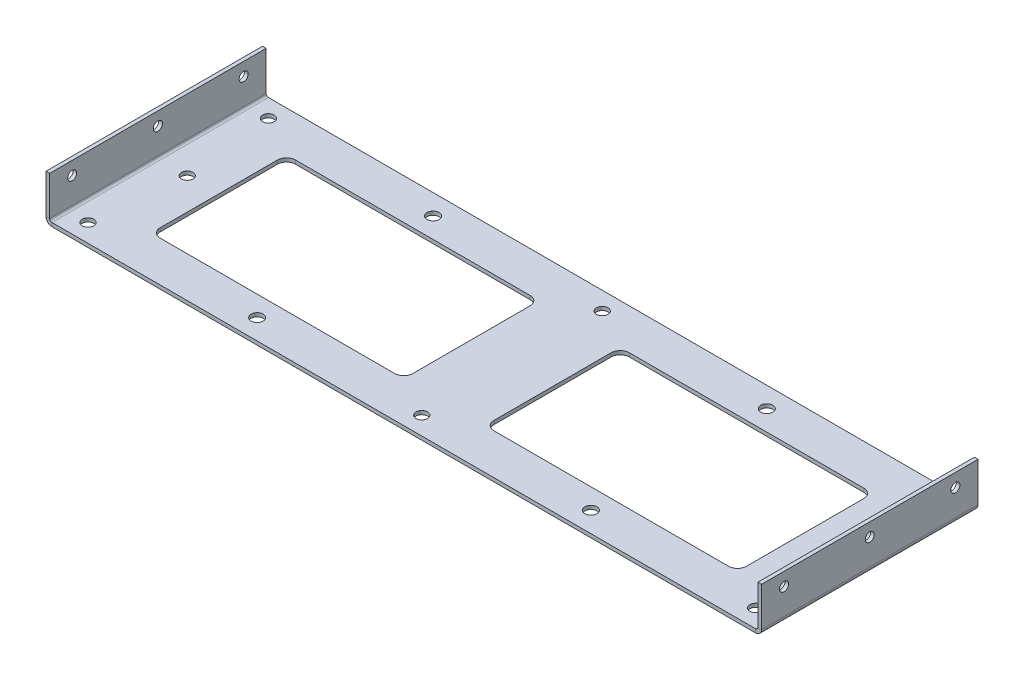
from build123d import *

# Parameters (mm, degrees)
SKETCH1_W               = 390
SKETCH1_H               = 120
SKETCH1_R               = 3.2
BOSS_EXTRUDE1_DEPTH     = 2.03
EDGE_FLANGE1_DEPTH      = 120
EDGE_FLANGE1_BEND_DEPTH = 120
CUT_EXTRUDE1_REACH      = 210.681
CUT_EXTRUDE2_DEPTH      = 209.447861347
CUT_EXTRUDE2_DEPTH_BACK = 209.447861347
SKETCH19_R              = 2.5
SKETCH20_R              = 3.35
CUT_EXTRUDE3_DEPTH      = 209.447861347
SKETCH21_R              = 3.175
CUT_EXTRUDE4_DEPTH      = 209.681312053


# Sheet-metal steps are written as plain solids
with BuildPart() as part:
    # Sketch1 → Boss-Extrude1 (new body)
    with BuildSketch(Plane(origin=(0, 0, 0), x_dir=(1, 0, 0), z_dir=(0, 1, 0))):
        Rectangle(SKETCH1_W, SKETCH1_H)
        with Locations(Location((0, 50, 0), (0, 0, 270))):
            Circle(SKETCH1_R, mode=Mode.SUBTRACT)
        with Locations(Location((-185, 50, 0), (0, 0, 270))):
            Circle(SKETCH1_R, mode=Mode.SUBTRACT)
        with Locations(Location((-185, -50, 0), (0, 0, 270))):
            Circle(SKETCH1_R, mode=Mode.SUBTRACT)
        with Locations(Location((0, -50, 0), (0, 0, 270))):
            Circle(SKETCH1_R, mode=Mode.SUBTRACT)
        with Locations(Location((185, -50, 0), (0, 0, 270))):
            Circle(SKETCH1_R, mode=Mode.SUBTRACT)
        with Locations(Location((185, 50, 0), (0, 0, 270))):
            Circle(SKETCH1_R, mode=Mode.SUBTRACT)
    extrude(amount=-BOSS_EXTRUDE1_DEPTH)

    # Edge-Flange1 section (across the edge) → Edge-Flange1 (add)
    with BuildSketch(Plane(origin=(-196.27, 0, -60), x_dir=(1, 0, 0), z_dir=(0, 0, 1))):
        with BuildLine():
            Line((-2.03, 1.27), (-2.03, 22.97))
            Line((-2.03, 22.97), (0, 22.97))
            Line((0, 22.97), (0, 1.27))
            ThreePointArc((0, 1.27), (0.371974388, 0.371974388), (1.27, 0))
            Line((1.27, 0), (1.27, -2.03))
            ThreePointArc((1.27, -2.03), (-1.063452378, -1.063452378), (-2.03, 1.27))
        make_face()
    extrude(amount=EDGE_FLANGE1_DEPTH)

    # Edge-Flange1 section 2 (across the edge) → Edge-Flange1 bend (add)
    with BuildSketch(Plane(origin=(196.27, 0, 60), x_dir=(-1, 0, 0), z_dir=(0, 0, -1))):
        with BuildLine():
            Line((-2.03, 1.27), (-2.03, 22.97))
            Line((-2.03, 22.97), (0, 22.97))
            Line((0, 22.97), (0, 1.27))
            ThreePointArc((0, 1.27), (0.371974388, 0.371974388), (1.27, 0))
            Line((1.27, 0), (1.27, -2.03))
            ThreePointArc((1.27, -2.03), (-1.063452378, -1.063452378), (-2.03, 1.27))
        make_face()
    extrude(amount=EDGE_FLANGE1_BEND_DEPTH)

    # Sketch18 → Cut-Extrude1 (cut, up to next)
    with BuildSketch(Plane.XZ.offset(2.03), mode=Mode.PRIVATE) as cut_extrude1_sk1:
        with BuildLine():
            Line((-157.5, -37.5), (-27.5, -37.5))
            ThreePointArc((-27.5, -37.5), (-23.964466094, -36.035533906), (-22.5, -32.5))
            Line((-22.5, -32.5), (-22.5, 32.5))
            ThreePointArc((-22.5, 32.5), (-23.964466094, 36.035533906), (-27.5, 37.5))
            Line((-27.5, 37.5), (-157.5, 37.5))
            ThreePointArc((-157.5, 37.5), (-161.035533906, 36.035533906), (-162.5, 32.5))
            Line((-162.5, 32.5), (-162.5, -32.5))
            ThreePointArc((-162.5, -32.5), (-161.035533906, -36.035533906), (-157.5, -37.5))
        make_face()
    cut_extrude1_tool1 = extrude(cut_extrude1_sk1.sketch, amount=-CUT_EXTRUDE1_REACH, mode=Mode.PRIVATE) & part.part
    # Sketch18 → Cut-Extrude1 (cut, up to next)
    with BuildSketch(Plane.XZ.offset(2.03), mode=Mode.PRIVATE) as cut_extrude1_sk2:
        with BuildLine():
            Line((22.5, -32.5), (22.5, 32.5))
            ThreePointArc((22.5, 32.5), (23.964466094, 36.035533906), (27.5, 37.5))
            Line((27.5, 37.5), (157.5, 37.5))
            ThreePointArc((157.5, 37.5), (161.035533906, 36.035533906), (162.5, 32.5))
            Line((162.5, 32.5), (162.5, -32.5))
            ThreePointArc((162.5, -32.5), (161.035533906, -36.035533906), (157.5, -37.5))
            Line((157.5, -37.5), (27.5, -37.5))
            ThreePointArc((27.5, -37.5), (23.964466094, -36.035533906), (22.5, -32.5))
        make_face()
    cut_extrude1_tool2 = extrude(cut_extrude1_sk2.sketch, amount=-CUT_EXTRUDE1_REACH, mode=Mode.PRIVATE) & part.part
    add(cut_extrude1_tool1.solids().sort_by_distance((-92.5, -2.03, 0))[0], mode=Mode.SUBTRACT)
    add(cut_extrude1_tool2.solids().sort_by_distance((92.5, -2.03, 0))[0], mode=Mode.SUBTRACT)

    # Sketch19 → Cut-Extrude2 (cut, two sides: drawn at the far end of the back side and taken through both)
    with BuildSketch(Plane(origin=(0, 0, 0), x_dir=(0, 0, -1), z_dir=(1, 0, 0)).offset(-CUT_EXTRUDE2_DEPTH_BACK)):
        with Locations((-47.5, 15.65)):
            Circle(SKETCH19_R)
        with Locations((0, 15.65)):
            Circle(SKETCH19_R)
        with Locations((47.5, 15.65)):
            Circle(SKETCH19_R)
    extrude(amount=CUT_EXTRUDE2_DEPTH + CUT_EXTRUDE2_DEPTH_BACK, mode=Mode.SUBTRACT)

    # Sketch20 → Cut-Extrude3 (cut, through all)
    with BuildSketch(Plane(origin=(0, 0, 0), x_dir=(1, 0, 0), z_dir=(0, 1, 0))):
        with Locations(Location((-92.5, -48.75, 0), (0, 0, 270))):
            Circle(SKETCH20_R)
        with Locations(Location((92.5, -48.75, 0), (0, 0, 90))):
            Circle(SKETCH20_R)
        with Locations(Location((92.5, 48.75, 0), (0, 0, 270))):
            Circle(SKETCH20_R)
        with Locations(Location((-92.5, 48.75, 0), (0, 0, 90))):
            Circle(SKETCH20_R)
    extrude(amount=-CUT_EXTRUDE3_DEPTH, mode=Mode.SUBTRACT)

    # Sketch21 → Cut-Extrude4 (cut, through all)
    with BuildSketch(Plane.XZ.offset(2.03)):
        with Locations(Location((-180, 0, 0), (0, 0, 270))):
            Circle(SKETCH21_R)
    extrude(amount=-CUT_EXTRUDE4_DEPTH, mode=Mode.SUBTRACT)


solid = part.part
